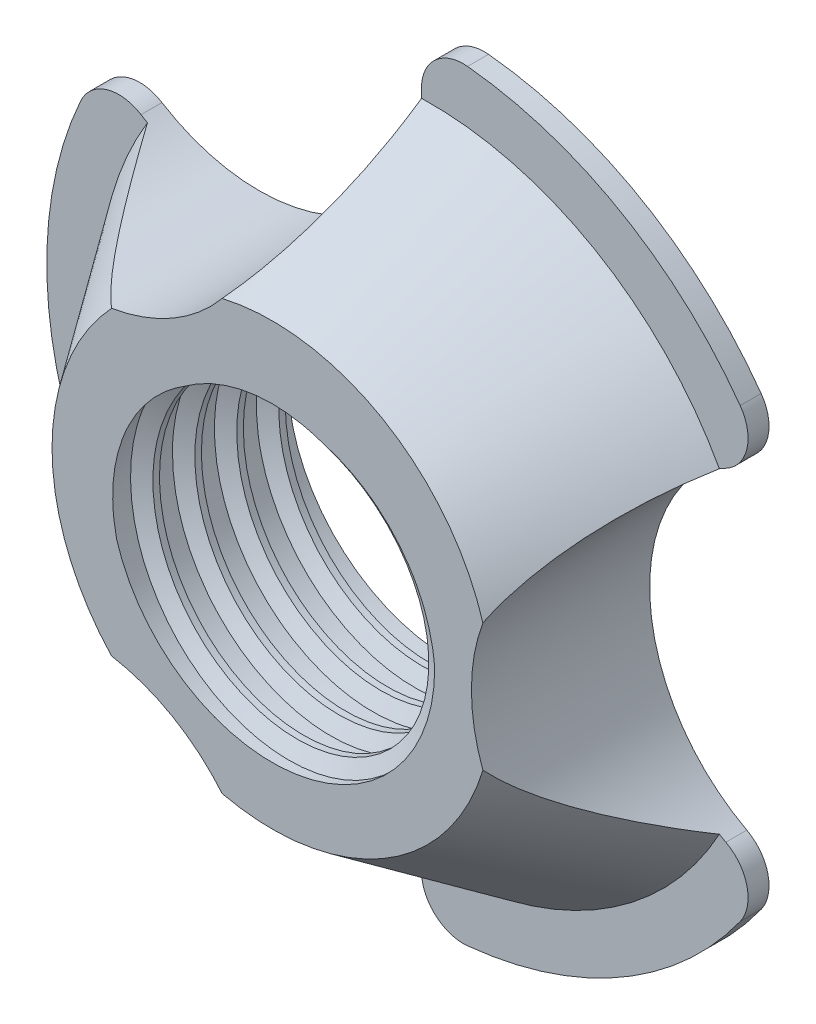
from build123d import *

# Parameters (mm, degrees)
SKETCH_2_R          = 21
EXTRUDE_2_DEPTH     = 15
EXTRUDE_2_DRAFT     = 35
SKETCH_6_R          = 36.503113073
EXTRUDE_3_DEPTH     = 2
SKETCH_7_R          = 17.5
CUT_EXTRUDE_1_DEPTH = 55.350294646
FILLET_1_R          = 4
SKETCH_9_R          = 15.5
CUT_EXTRUDE_2_DEPTH = 55.24196116
THREAD_1_PITCH      = 4
THREAD_1_FROM       = 10
THREAD_1_TO         = 27


with BuildPart() as part:
    # Эскиз2 → Бобышка-Вытянуть2 (with draft: the straight prism first)
    with BuildSketch(Plane.XY):
        Circle(SKETCH_2_R)
    extrude(amount=-EXTRUDE_2_DEPTH)
    # Бобышка-Вытянуть2: the draft: its side faces are tilted about the plane it starts from
    extrude_2_sides = [part.faces().sort_by_distance(p)[0] for p in [
        (-21, 0, -7.5),
    ]]
    draft(extrude_2_sides, Plane.XY, EXTRUDE_2_DRAFT)

    # Эскиз6 → Бобышка-Вытянуть3 (add)
    with BuildSketch(Plane(origin=(0, 0, -15), x_dir=(-1, 0, 0), z_dir=(0, 0, -1))):
        Circle(SKETCH_6_R)
    extrude(amount=EXTRUDE_3_DEPTH)

    # Эскиз7 → Вырез-Вытянуть1 (cut, through all)
    with BuildSketch(Plane(origin=(0, 0, -17), x_dir=(-1, 0, 0), z_dir=(0, 0, -1))):
        with Locations((-36.503113073, 0)):
            Circle(SKETCH_7_R)
        with Locations((18.251556537, 31.612623239)):
            Circle(SKETCH_7_R)
        with Locations((18.251556537, -31.612623239)):
            Circle(SKETCH_7_R)
    extrude(amount=-CUT_EXTRUDE_1_DEPTH, mode=Mode.SUBTRACT)

    # Скругление1
    fillet_1_edges = [part.edges().sort_by_distance(p)[0] for p in [
        (32.308265371, 16.989798491, -16),
        (32.308265371, -16.989798491, -16),
        (-30.867729784, 19.484879318, -16),
        (-1.440535587, 36.474677809, -16),
        (-1.440535587, -36.474677809, -16),
        (-30.867729784, -19.484879318, -16),
    ]]
    fillet(fillet_1_edges, radius=FILLET_1_R)

    # Эскиз9 → Вырез-Вытянуть2 (cut, through all)
    with BuildSketch(Plane.XY):
        Circle(SKETCH_9_R)
    extrude(amount=-CUT_EXTRUDE_2_DEPTH, mode=Mode.SUBTRACT)

    # Резьба1: arcs per turn and ends read off the stored shape
    # Резьба1: the profile of Профиль резьбы1 profile screwed along a right-hand helix through 6.75 turns, 12 arcs to a turn; built about Z, then put on its axis
    thread_1_z = Axis((0, 0, 0), (0, 0, 1))
    thread_1_corners = [(15.5003, 0, -0.000173205), (15.5003, 0, 2.187673198), (14.146835313, 0, 1.406249997), (14.146835313, 0, 0.781249997)]
    with BuildLine(mode=Mode.PRIVATE) as thread_1_profile:
        Line(thread_1_corners[0], thread_1_corners[1])
        Line(thread_1_corners[1], thread_1_corners[2])
        Line(thread_1_corners[2], thread_1_corners[3])
        Line(thread_1_corners[3], thread_1_corners[0])
    thread_1_cap = Face(thread_1_profile.wire())
    thread_1_turn_angles = [0, 15, 30, 45, 60, 75, 90, 105, 120, 135, 150, 165, 180, 195, 210, 225, 240, 255, 270, 285, 300, 315, 330, 345, 360]
    thread_1_turn_weights = [1, 0.9659258262890683, 1, 0.9659258262890683, 1, 0.9659258262890683, 1, 0.9659258262890683, 1, 0.9659258262890683, 1, 0.9659258262890683, 1, 0.9659258262890683, 1, 0.9659258262890683, 1, 0.9659258262890683, 1, 0.9659258262890683, 1, 0.9659258262890683, 1, 0.9659258262890683, 1]
    thread_1_turn_rails = [Edge.make_bspline([Vector(p[0], p[1], 0).rotate(thread_1_z, thread_1_turn_angles[k]) / thread_1_turn_weights[k] + Vector(0, 0, p[2] + THREAD_1_PITCH * thread_1_turn_angles[k] / 360) for k in range(25)], [0, 0, 0, 1, 1, 2, 2, 3, 3, 4, 4, 5, 5, 6, 6, 7, 7, 8, 8, 9, 9, 10, 10, 11, 11, 12, 12, 12], 2, thread_1_turn_weights) for p in thread_1_corners]
    thread_1_turn_sides = [Face.make_surface_from_curves(thread_1_turn_rails[p[0]], thread_1_turn_rails[p[1]]) for p in [(0, 1), (1, 2), (2, 3), (3, 0)]]
    thread_1_last_angles = [2160, 2175, 2190, 2205, 2220, 2235, 2250, 2265, 2280, 2295, 2310, 2325, 2340, 2355, 2370, 2385, 2400, 2415, 2430]
    thread_1_last_weights = [1, 0.9659258262890683, 1, 0.9659258262890683, 1, 0.9659258262890683, 1, 0.9659258262890683, 1, 0.9659258262890683, 1, 0.9659258262890683, 1, 0.9659258262890683, 1, 0.9659258262890683, 1, 0.9659258262890673, 1]
    thread_1_last_rails = [Edge.make_bspline([Vector(p[0], p[1], 0).rotate(thread_1_z, thread_1_last_angles[k]) / thread_1_last_weights[k] + Vector(0, 0, p[2] + THREAD_1_PITCH * thread_1_last_angles[k] / 360) for k in range(19)], [0, 0, 0, 1, 1, 2, 2, 3, 3, 4, 4, 5, 5, 6, 6, 7, 7, 8, 8, 9, 9, 9], 2, thread_1_last_weights) for p in thread_1_corners]
    thread_1_last_sides = [Face.make_surface_from_curves(thread_1_last_rails[p[0]], thread_1_last_rails[p[1]]) for p in [(0, 1), (1, 2), (2, 3), (3, 0)]]
    thread_1 = Plane(origin=(0, 0, 10), x_dir=(-1, 0, 0), z_dir=(0, 0, -1)) * split(split(Solid(Shell([*[p.moved(Location((0, 0, THREAD_1_PITCH * i))) for i in range(6) for p in thread_1_turn_sides], *thread_1_last_sides, thread_1_cap, thread_1_cap.rotate(thread_1_z, 2430).moved(Location((0, 0, THREAD_1_PITCH * 2430 / 360)))])), bisect_by=Plane.XY.offset(THREAD_1_FROM), keep=Keep.TOP, mode=Mode.PRIVATE), bisect_by=Plane.XY.offset(THREAD_1_TO), keep=Keep.BOTTOM, mode=Mode.PRIVATE)
    add(thread_1)


solid = part.part
